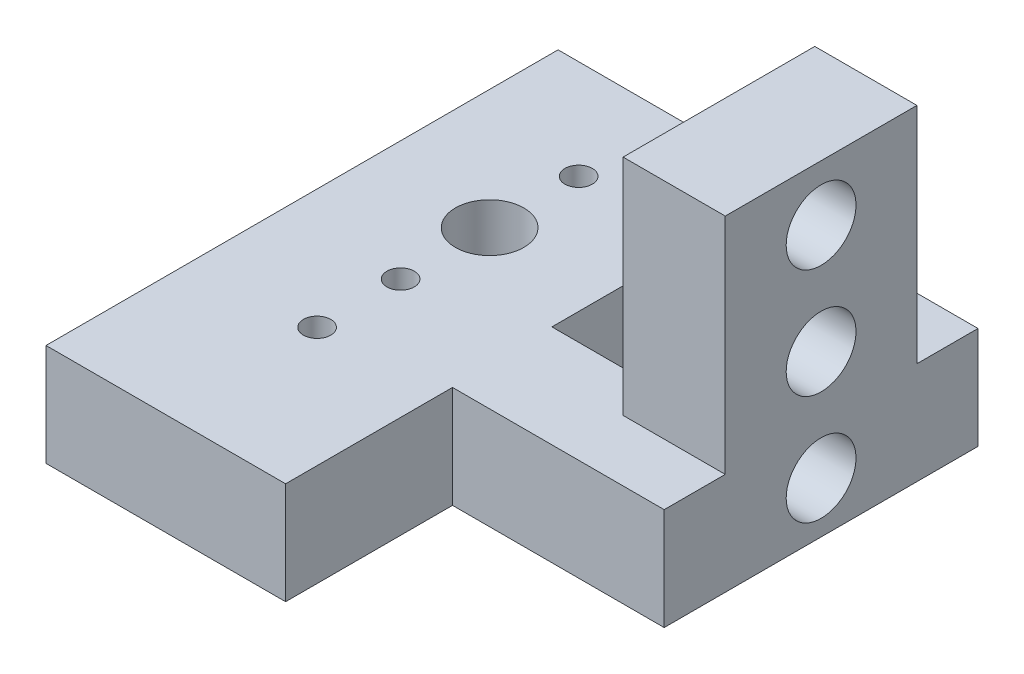
from build123d import *

# Parameters (mm, degrees)
SKETCH1_W           = 8.2
SKETCH1_H           = 8
BOSS_EXTRUDE1_DEPTH = 7.46
BOSS_EXTRUDE2_DEPTH = 16.34
SKETCH4_R           = 2.55
CUT_EXTRUDE1_DEPTH  = 43.142763317
CUT_EXTRUDE2_DEPTH  = 2
CUT_EXTRUDE4_REACH  = 42.258
SKETCH6_R           = 1
SKETCH7_R           = 2.5
CUT_EXTRUDE5_DEPTH  = 41.257752049


with BuildPart() as part:
    # Sketch1 → Boss-Extrude1 (new body)
    with BuildSketch(Plane(origin=(0, 0, 0), x_dir=(1, 0, 0), z_dir=(0, 1, 0))):
        Polygon((8.75, 11.46), (24.21, 11.46), (24.21, -11.46), (8.75, -11.46), (8.75, -23.65), (-8.75, -23.65), (-8.75, 13.75), (8.75, 13.75), align=None)
        with Locations((12.65, 0)):
            Rectangle(SKETCH1_W, SKETCH1_H, mode=Mode.SUBTRACT)
    extrude(amount=BOSS_EXTRUDE1_DEPTH)

    # Sketch3 → Boss-Extrude2 (add)
    with BuildSketch(Plane(origin=(0, 7.46, 0), x_dir=(1, 0, 0), z_dir=(0, 1, 0))):
        Polygon((16.75, 7), (24.21, 7), (24.21, -7), (16.75, -7), (16.75, -4), (16.75, 4), align=None)
    extrude(amount=BOSS_EXTRUDE2_DEPTH)

    # Sketch4 → Cut-Extrude1 (cut, through all)
    with BuildSketch(Plane.ZY.offset(-16.75)):
        with Locations((0, 3.73)):
            Circle(SKETCH4_R)
        with Locations((0, 11.73)):
            Circle(SKETCH4_R)
        with Locations((0, 19.73)):
            Circle(SKETCH4_R)
    extrude(amount=-CUT_EXTRUDE1_DEPTH, mode=Mode.SUBTRACT)

    # Sketch5 → Cut-Extrude2 (cut)
    with BuildSketch(Plane.XZ):
        with BuildLine():
            Line((-2.113983221, 14.966101695), (-3.606206671, 0.368644068))
            ThreePointArc((-3.606206671, 0.368644068), (-3.625, 0), (-3.606206671, -0.368644068))
            Line((-3.606206671, -0.368644068), (-2.113983221, -14.966101695))
            ThreePointArc((-2.113983221, -14.966101695), (0, -16.875), (2.113983221, -14.966101695))
            Line((2.113983221, -14.966101695), (3.606206671, -0.368644068))
            ThreePointArc((3.606206671, -0.368644068), (3.625, 0), (3.606206671, 0.368644068))
            Line((3.606206671, 0.368644068), (2.113983221, 14.966101695))
            ThreePointArc((2.113983221, 14.966101695), (0, 16.875), (-2.113983221, 14.966101695))
        make_face()
    extrude(amount=-CUT_EXTRUDE2_DEPTH, mode=Mode.SUBTRACT)

    # Sketch6 → Cut-Extrude4 (cut, up to next)
    with BuildSketch(Plane.XZ.offset(-2), mode=Mode.PRIVATE) as cut_extrude4_sk1:
        with Locations((0, 12.6)):
            Circle(SKETCH6_R)
    cut_extrude4_tool1 = extrude(cut_extrude4_sk1.sketch, amount=-CUT_EXTRUDE4_REACH, mode=Mode.PRIVATE) & part.part
    # Sketch6 → Cut-Extrude4 (cut, up to next)
    with BuildSketch(Plane.XZ.offset(-2), mode=Mode.PRIVATE) as cut_extrude4_sk2:
        with Locations((0, 6.5)):
            Circle(SKETCH6_R)
    cut_extrude4_tool2 = extrude(cut_extrude4_sk2.sketch, amount=-CUT_EXTRUDE4_REACH, mode=Mode.PRIVATE) & part.part
    # Sketch6 → Cut-Extrude4 (cut, up to next)
    with BuildSketch(Plane.XZ.offset(-2), mode=Mode.PRIVATE) as cut_extrude4_sk3:
        with Locations((0, -6.5)):
            Circle(SKETCH6_R)
    cut_extrude4_tool3 = extrude(cut_extrude4_sk3.sketch, amount=-CUT_EXTRUDE4_REACH, mode=Mode.PRIVATE) & part.part
    add(cut_extrude4_tool1.solids().sort_by_distance((0, 2, 12.6))[0], mode=Mode.SUBTRACT)
    add(cut_extrude4_tool2.solids().sort_by_distance((0, 2, 6.5))[0], mode=Mode.SUBTRACT)
    add(cut_extrude4_tool3.solids().sort_by_distance((0, 2, -6.5))[0], mode=Mode.SUBTRACT)

    # Sketch7 → Cut-Extrude5 (cut, through all)
    with BuildSketch(Plane.XZ.offset(-2)):
        Circle(SKETCH7_R)
    extrude(amount=-CUT_EXTRUDE5_DEPTH, mode=Mode.SUBTRACT)


solid = part.part
